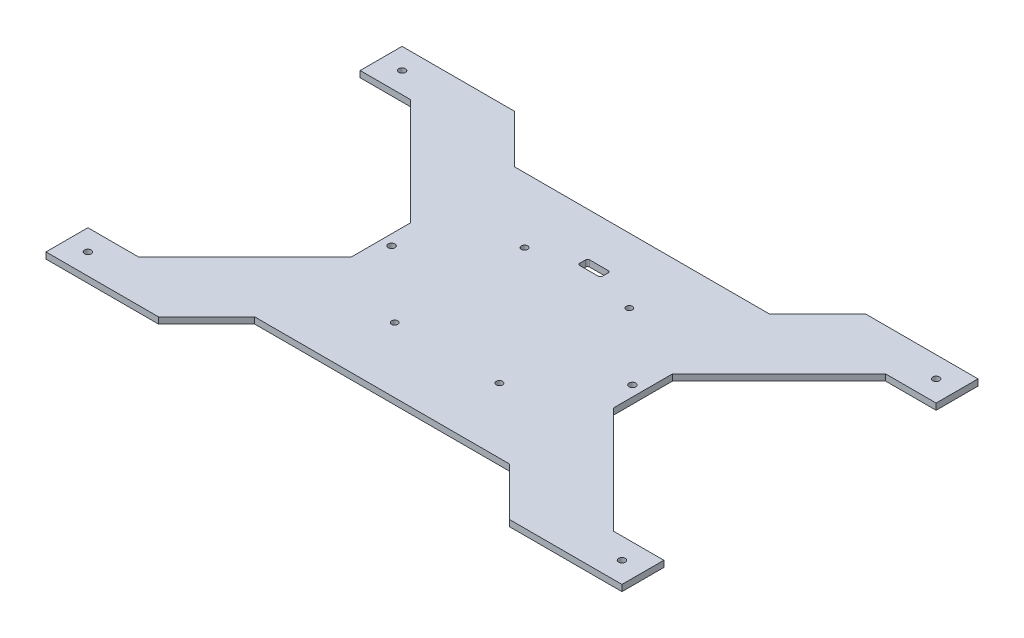
from build123d import *

# Parameters (mm, degrees)
SKETCH1_R          = 1.6
EXTRUDE2_DEPTH     = 3
CUT_EXTRUDE4_DEPTH = 3


with BuildPart() as part:
    # Sketch1 → Extrude2 (new body)
    with BuildSketch(Plane.XZ):
        Polygon((2.632056859, -227.497048214), (53.489921235, -278.35491259), (53.489921235, -306.639183837), (2.632056859, -357.497048214), (-21.510078765, -357.497048214), (-21.510078765, -377.497048214), (32.129531542, -377.497048214), (55.092111961, -354.534467794), (176.887730509, -354.534467794), (199.850310928, -377.497048214), (253.489921235, -377.497048214), (253.489921235, -357.497048214), (229.347785611, -357.497048214), (178.489921235, -306.639183837), (178.489921235, -278.35491259), (229.347785611, -227.497048214), (253.489921235, -227.497048214), (253.489921235, -207.497048214), (199.850310928, -207.497048214), (176.887730509, -230.459628633), (55.092111961, -230.459628633), (32.129531542, -207.497048214), (-21.510078765, -207.497048214), (-21.510078765, -227.497048214), align=None)
        with Locations((-11.510078765, -217.497048214)):
            Circle(SKETCH1_R, mode=Mode.SUBTRACT)
        with Locations((243.489921235, -217.497048214)):
            Circle(SKETCH1_R, mode=Mode.SUBTRACT)
        with Locations((58.489921235, -292.497048214)):
            Circle(SKETCH1_R, mode=Mode.SUBTRACT)
        with Locations((173.489921235, -292.497048214)):
            Circle(SKETCH1_R, mode=Mode.SUBTRACT)
        with Locations((243.489921235, -367.497048214)):
            Circle(SKETCH1_R, mode=Mode.SUBTRACT)
        with Locations((-11.510078765, -367.497048214)):
            Circle(SKETCH1_R, mode=Mode.SUBTRACT)
    extrude(amount=EXTRUDE2_DEPTH)

    # Sketch4 → Cut-Extrude4 (cut)
    with BuildSketch(Plane.XZ.offset(3)):
        with BuildLine():
            Line((121.389921235, -332.984350137), (121.389921235, -330.284350137))
            ThreePointArc((121.389921235, -330.284350137), (121.097028016, -329.577243356), (120.389921235, -329.284350137))
            Line((120.389921235, -329.284350137), (111.589921235, -329.284350137))
            ThreePointArc((111.589921235, -329.284350137), (110.882814454, -329.577243356), (110.589921235, -330.284350137))
            Line((110.589921235, -330.284350137), (110.589921235, -332.984350137))
            ThreePointArc((110.589921235, -332.984350137), (110.882814454, -333.691456918), (111.589921235, -333.984350137))
            Line((111.589921235, -333.984350137), (120.389921235, -333.984350137))
            ThreePointArc((120.389921235, -333.984350137), (121.097028016, -333.691456918), (121.389921235, -332.984350137))
        make_face()
        with BuildLine():
            ThreePointArc((142.489921235, -261.497048214), (140.989921235, -259.997048214), (139.489921235, -261.497048214))
            ThreePointArc((139.489921235, -261.497048214), (140.989921235, -262.997048214), (142.489921235, -261.497048214))
        make_face()
        with BuildLine():
            ThreePointArc((139.489921235, -323.497048214), (140.989921235, -324.997048214), (142.489921235, -323.497048214))
            ThreePointArc((142.489921235, -323.497048214), (140.989921235, -321.997048214), (139.489921235, -323.497048214))
        make_face()
        with BuildLine():
            ThreePointArc((92.489921235, -261.497048214), (90.989921235, -259.997048214), (89.489921235, -261.497048214))
            ThreePointArc((89.489921235, -261.497048214), (90.989921235, -262.997048214), (92.489921235, -261.497048214))
        make_face()
        with BuildLine():
            ThreePointArc((92.489921235, -323.497048214), (90.989921235, -321.997048214), (89.489921235, -323.497048214))
            ThreePointArc((89.489921235, -323.497048214), (90.989921235, -324.997048214), (92.489921235, -323.497048214))
        make_face()
    extrude(amount=-CUT_EXTRUDE4_DEPTH, mode=Mode.SUBTRACT)


solid = part.part
